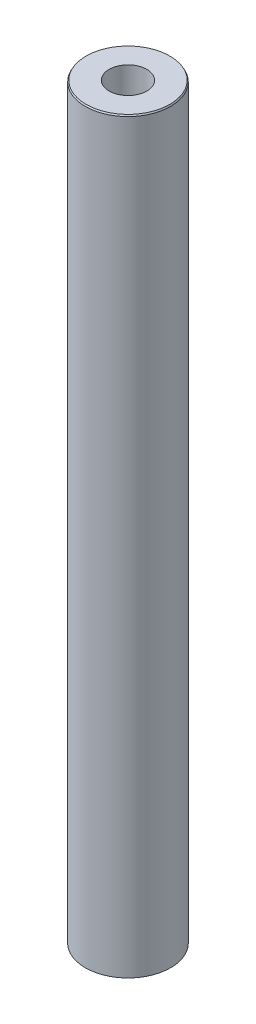
from build123d import *
from OCP.BRepFilletAPI import BRepFilletAPI_MakeChamfer

# Parameters (mm, degrees)
SKETCH1_R           = 10
BOSS_EXTRUDE1_DEPTH = 175.328501605
SKETCH2_R           = 4.413948399
CUT_EXTRUDE1_DEPTH  = 176.897934823
CHAMFER1_SIZE       = 0.323305587
CHAMFER1_SIZE2      = 0.186660568


with BuildPart() as part:
    # Sketch1 → Boss-Extrude1 (new body)
    with BuildSketch(Plane(origin=(0, 0, 0), x_dir=(1, 0, 0), z_dir=(0, 1, 0))):
        Circle(SKETCH1_R)
    extrude(amount=BOSS_EXTRUDE1_DEPTH)

    # Sketch2 → Cut-Extrude1 (cut, through all)
    with BuildSketch(Plane(origin=(0, 0, 0), x_dir=(1, 0, 0), z_dir=(0, 1, 0))):
        Circle(SKETCH2_R)
    extrude(amount=CUT_EXTRUDE1_DEPTH, mode=Mode.SUBTRACT)

    # Chamfer1: one chamfer whose edges measure the first distance from different faces: ONE call of the kernel's chamfer builder (chamfer() names one face for all edges)
    chamfer1_edges_1 = [part.edges().sort_by_distance(p)[0] for p in [
        (-10, 175.328501605, 0),
    ]]
    chamfer1_side_1 = [part.faces().sort_by_distance(p)[0] for p in [
        (-10, 87.664250803, 0),
    ]]
    chamfer1_edges_2 = [part.edges().sort_by_distance(p)[0] for p in [
        (-10, 0, 0),
    ]]
    chamfer1_side_2 = [part.faces().sort_by_distance(p)[0] for p in [
        (-9.717157288, 0, 0),
    ]]
    chamfer1 = BRepFilletAPI_MakeChamfer(part.part.solid().wrapped)
    for e in chamfer1_edges_1:
        chamfer1.Add(CHAMFER1_SIZE, CHAMFER1_SIZE2, e.wrapped, chamfer1_side_1[0].wrapped)  # the first distance lies on this face
    for e in chamfer1_edges_2:
        chamfer1.Add(CHAMFER1_SIZE, CHAMFER1_SIZE2, e.wrapped, chamfer1_side_2[0].wrapped)  # the first distance lies on this face
    add(Compound.cast(chamfer1.Shape()), mode=Mode.REPLACE)


solid = part.part
